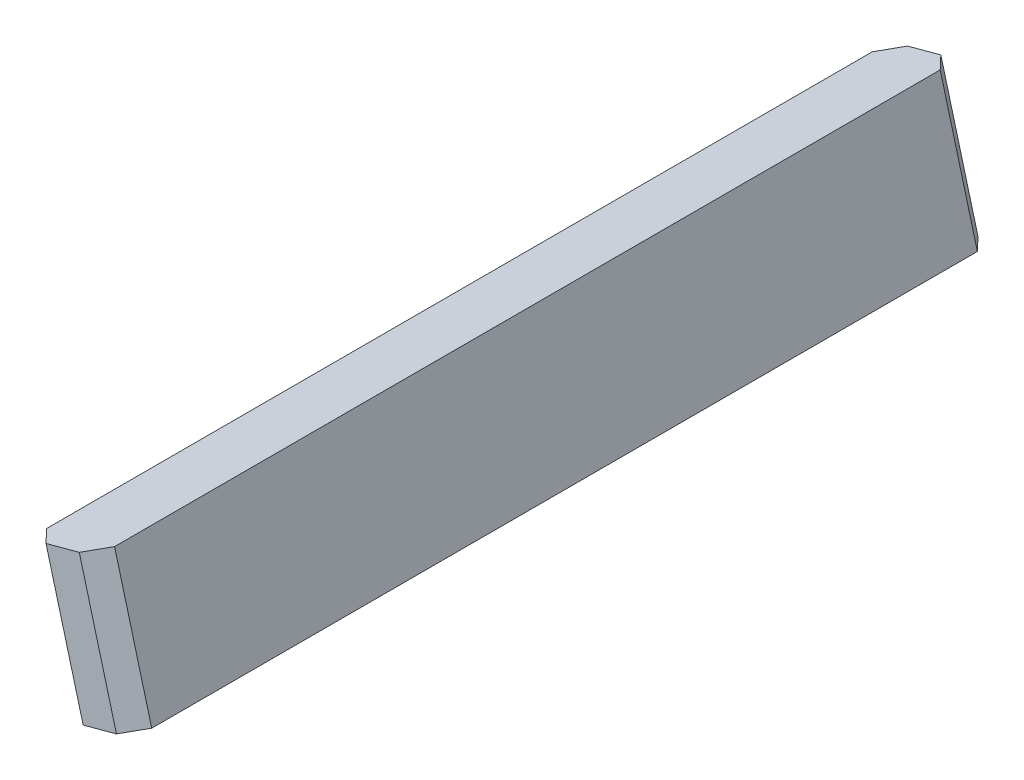
from build123d import *

# Parameters (mm, degrees)
BOSS_EXTRUDE1_DEPTH    = 60
CUT_EXTRUDE1_DEPTH     = 128.644720336
MOVE_START             = 10
MOVE_FACE1_OUTLINE_W   = 23
MOVE_FACE1_OUTLINE_H   = 122
MOVE_FACE1_DEPTH       = 0.1
MOVE_START_2           = 19.9
MOVE_FACE1_2_OUTLINE_W = 23
MOVE_FACE1_2_OUTLINE_H = 122
MOVE_FACE1_2_DEPTH     = 0.1
CHAMFER1_SIZE          = 2.5


# Read off the part's stored shape, not the designer's step: Move Face1
with BuildPart() as part:
    # Sketch1 → Boss-Extrude1 (new, symmetric)
    with BuildSketch(Plane.XY):
        Polygon((0, 38.637033052), (10.352761804, 0), (20.008855708, 2.6), (10.352761804, 38.637033052), align=None)
    extrude(amount=BOSS_EXTRUDE1_DEPTH, both=True)

    # Sketch2 → Cut-Extrude1 (cut, through all)
    with BuildSketch(Plane.XY.offset(60)):
        Polygon((5.176380902, 19.318516526), (14.832474806, 21.918516526), (10.352761804, 38.637033052), (0, 38.637033052), align=None)
    extrude(amount=-CUT_EXTRUDE1_DEPTH, mode=Mode.SUBTRACT)

    # Move Face1 outline → Move Face1 (cut)
    with BuildSketch(Plane(origin=(0, 0, 0), x_dir=(-0.258819045102515, 0.9659258262890698, 0), z_dir=(0.9659258262890699, 0.258819045102515, 0)).offset(MOVE_START)):
        with Locations((7.5, 0)):
            Rectangle(MOVE_FACE1_OUTLINE_W, MOVE_FACE1_OUTLINE_H)
    extrude(amount=MOVE_FACE1_DEPTH, mode=Mode.SUBTRACT)

    # Move Face1 2 outline → Move Face1 2 (cut)
    with BuildSketch(Plane(origin=(0, 0, 0), x_dir=(-0.258819045102515, 0.9659258262890698, 0), z_dir=(0.9659258262890699, 0.258819045102515, 0)).offset(MOVE_START_2)):
        with Locations((7.5, 0)):
            Rectangle(MOVE_FACE1_2_OUTLINE_W, MOVE_FACE1_2_OUTLINE_H)
    extrude(amount=MOVE_FACE1_2_DEPTH, mode=Mode.SUBTRACT)

    # Chamfer1
    chamfer1_edges = [part.edges().sort_by_distance(p)[0] for p in [
        (7.861132292, 9.685258263, -60),
        (7.861132292, 9.685258263, 60),
        (17.324104318, 12.233258263, -60),
        (17.324104318, 12.233258263, 60),
    ]]
    chamfer(chamfer1_edges, length=CHAMFER1_SIZE)


solid = part.part
